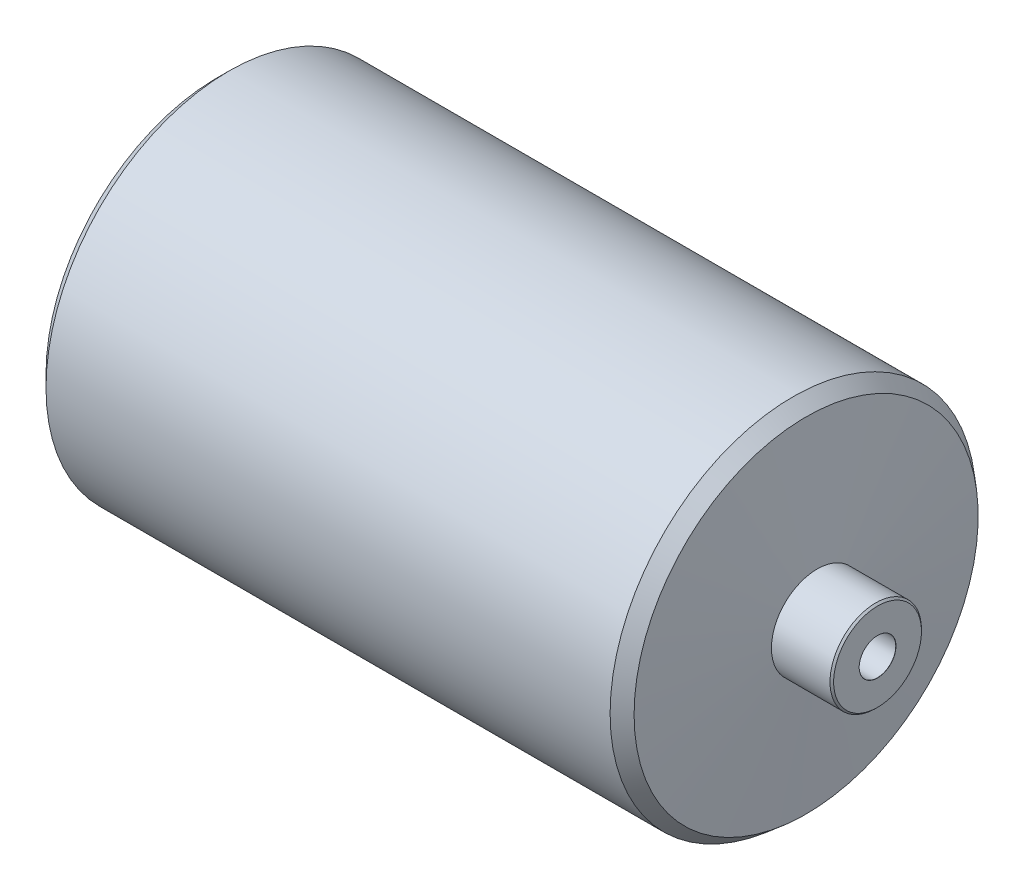
from build123d import *
from build123d.topology import SkipClean

# Parameters (mm, degrees)
SKETCH2_R           = 50
BOSS_EXTRUDE1_DEPTH = 100
CUT_EXTRUDE1_START  = -16.5
SKETCH3_R           = 50
SKETCH3_R_2         = 12.5
CUT_EXTRUDE1_DEPTH  = 16.5
CHAMFER2_SIZE       = 0.5
CHAMFER3_SIZE       = 3
CHAMFER3_SIZE_2     = 3.300188603


# Read off the part's stored shape, not the designer's step: Mirror1
with BuildPart() as part:
    # Sketch2 → Boss-Extrude1 (new body)
    with BuildSketch(Plane.YZ):
        with Locations(Location((0, 0, 0), (0, 0, 270))):
            Circle(SKETCH2_R)
    extrude(amount=BOSS_EXTRUDE1_DEPTH)

    # Sketch3 → Cut-Extrude1 (cut)
    with BuildSketch(Plane.YZ.offset(100).offset(CUT_EXTRUDE1_START)):
        with Locations(Location((0, 0, 0), (0, 0, 270))):
            Circle(SKETCH3_R)
        with Locations(Location((0, 0, 0), (0, 0, 270))):
            Circle(SKETCH3_R_2, mode=Mode.SUBTRACT)
    extrude(amount=CUT_EXTRUDE1_DEPTH, mode=Mode.SUBTRACT)

    # Chamfer2
    chamfer2_edges = [part.edges().sort_by_distance(p)[0] for p in [
        (100, 0, 12.5),
    ]]
    chamfer(chamfer2_edges, length=CHAMFER2_SIZE)

    # Sketch4 → Cut-Revolve2 (revolve, cut)
    with BuildSketch(Plane(origin=(0, 0, 0), x_dir=(-1, 0, 0), z_dir=(0, 1, 0))):
        Polygon((-83.5, 12.5), (-80.219175118, 50), (-83.5, 50), align=None)
    revolve(axis=Axis((0, 0, 0), (1, 0, 0)), mode=Mode.SUBTRACT)

    # Chamfer3
    # the kernel refuses this chamfer: 3.300188603, 3 mm, written as the material it takes off along each edge
    with BuildSketch(Plane(origin=(80.219175118, 0, 0), x_dir=(0, 0, 1), z_dir=(0, 1, 0))) as chamfer3_piece_1:
        Polygon((50 - CHAMFER3_SIZE * 0.996194698092, CHAMFER3_SIZE * 0.0871557427477), (50, -CHAMFER3_SIZE_2), (50, 0), align=None)
    revolve(axis=Axis((80.219175118, 0, 0), (1, 0, 0)), revolution_arc=180, mode=Mode.SUBTRACT)
    with BuildSketch(Plane(origin=(80.219175118, 0, 0), x_dir=(0, 0, -1), z_dir=(0, -1, 0))) as chamfer3_piece_2:
        Polygon((50 - CHAMFER3_SIZE * 0.996194698092, CHAMFER3_SIZE * 0.0871557427477), (50, -CHAMFER3_SIZE_2), (50, 0), align=None)
    revolve(axis=Axis((80.219175118, 0, 0), (1, 0, 0)), revolution_arc=180, mode=Mode.SUBTRACT)

    # Sketch7 → M10 Tapped Hole1 (revolve, cut)
    with BuildSketch(Plane(origin=(100, 0, 0), x_dir=(0, 0, -1), z_dir=(0, 1, 0))):
        Polygon((0, 0), (0, 59), (4.25, 56.446342369), (4.25, 50), (5, 50), (5, 0.025), (5.025, 0), align=None)
    revolve(axis=Axis((106.35, 0, 0), (-1, 0, 0)), mode=Mode.SUBTRACT)

    # Mirror1 outline → Mirror1 (revolve)
    with SkipClean():  # the faces are left unmerged after this step: merging them gives an invalid solid
        with BuildSketch(Plane.YX):
            Polygon((50, 0), (0, 0), (0, -41), (4.25, -43.553657631), (4.25, -50), (5, -50), (5, -99.975), (5.025, -100), (12, -100), (12.5, -99.5), (12.5, -83.5), (46.712369611, -80.506805507), (50, -77.219175118), align=None)
        revolve(axis=Axis((0, 0, 0), (1, 0, 0)))
    add(part.part.scale(1), mode=Mode.REPLACE)  # the faces are merged on a copy


solid = part.part
